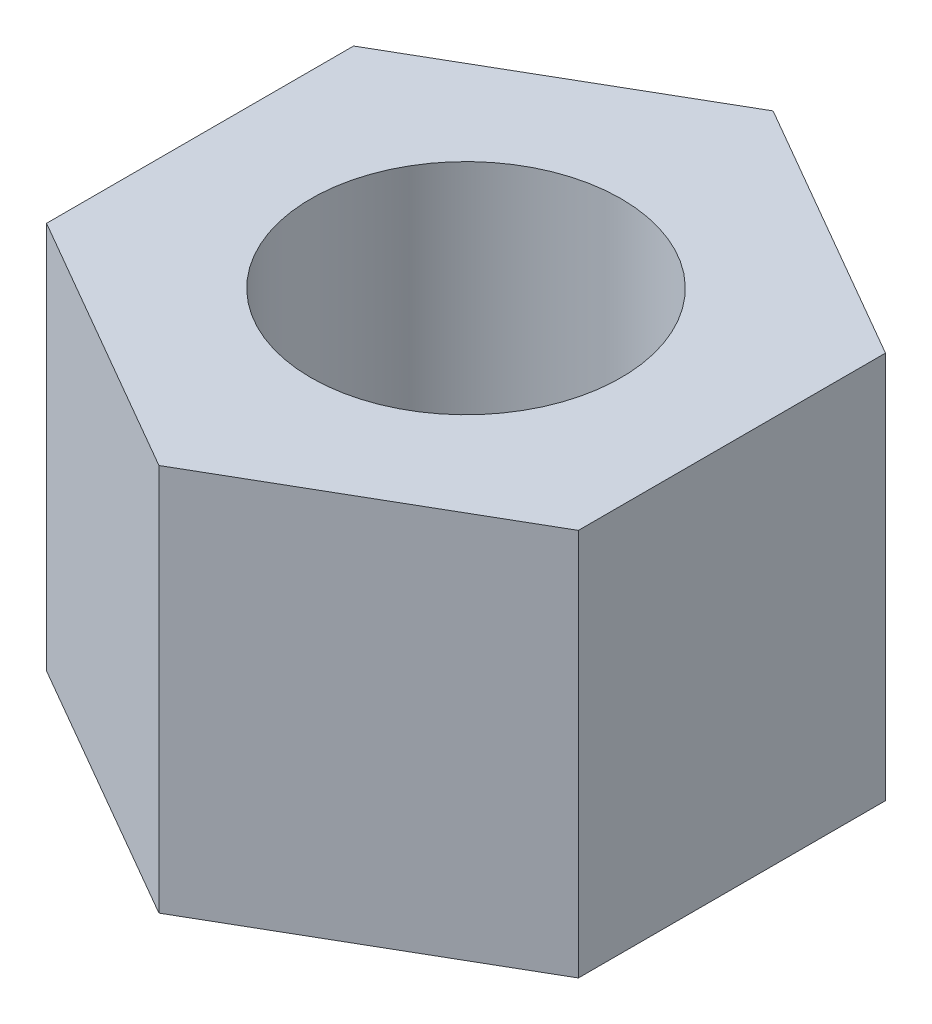
from build123d import *

# Parameters (mm, degrees)
SKETCH_1_R      = 2
EXTRUDE_1_DEPTH = 5


with BuildPart() as part:
    # Эскиз1 → Вытянуть1 (new body)
    with BuildSketch(Plane(origin=(0, 0, 0), x_dir=(1, 0, 0), z_dir=(0, 1, 0))):
        Polygon((0, -3.960622847), (3.43, -1.980311423), (3.43, 1.980311423), (0, 3.960622847), (-3.43, 1.980311423), (-3.43, -1.980311423), align=None)
        Circle(SKETCH_1_R, mode=Mode.SUBTRACT)
    extrude(amount=EXTRUDE_1_DEPTH)


solid = part.part
